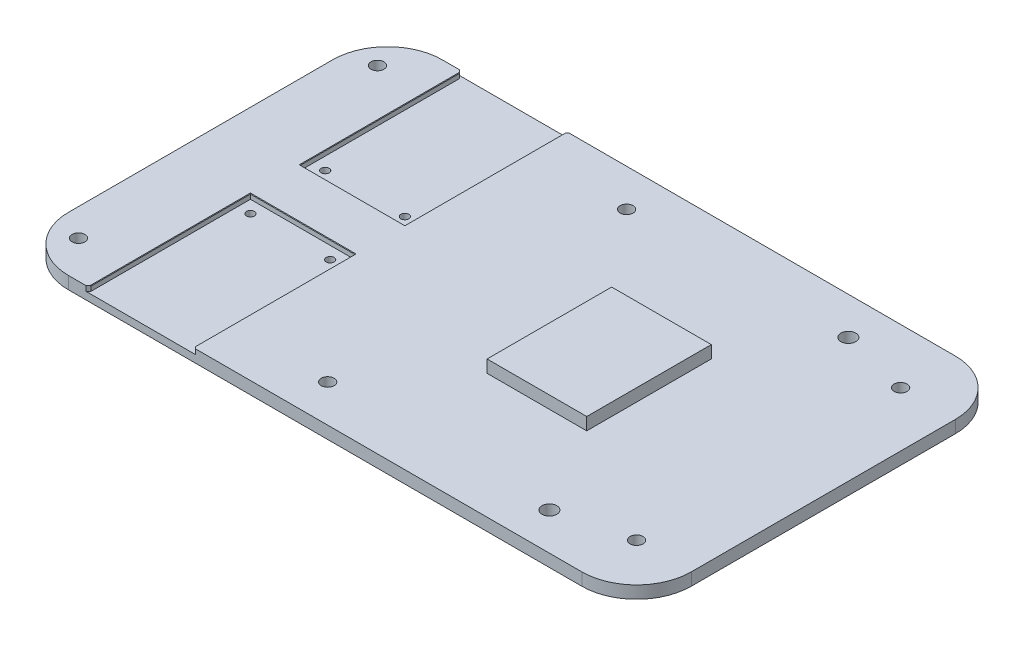
from build123d import *

# Parameters (mm, degrees)
SKETCH_1_R          = 2.6
SKETCH_1_R_2        = 3
EXTRUDE_1_DEPTH     = 5
SKETCH_2_W          = 42
SKETCH_2_H          = 65
CUT_EXTRUDE_1_DEPTH = 2
CHAMFER_1_SIZE      = 0.2
CHAMFER_2_SIZE      = 1
SKETCH_3_R          = 1.6
CUT_EXTRUDE_2_DEPTH = 3
SKETCH_4_W          = 40
SKETCH_4_H          = 50
EXTRUDE_2_DEPTH     = 5


with BuildPart() as part:
    # 草图1 → 凸台-拉伸1 (new body)
    with BuildSketch(Plane(origin=(0, 0, 0), x_dir=(1, 0, 0), z_dir=(0, 1, 0))):
        with BuildLine():
            Line((103, 75), (-103, 75))
            ThreePointArc((-103, 75), (-118.556349186, 68.556349186), (-125, 53))
            Line((-125, 53), (-125, -53))
            ThreePointArc((-125, -53), (-118.556349186, -68.556349186), (-103, -75))
            Line((-103, -75), (103, -75))
            ThreePointArc((103, -75), (118.556349186, -68.556349186), (125, -53))
            Line((125, -53), (125, 53))
            ThreePointArc((125, 53), (118.556349186, 68.556349186), (103, 75))
        make_face()
        with Locations((-114, 60)):
            Circle(SKETCH_1_R, mode=Mode.SUBTRACT)
        with Locations((-14, 60)):
            Circle(SKETCH_1_R, mode=Mode.SUBTRACT)
        with Locations((103, 53)):
            Circle(SKETCH_1_R, mode=Mode.SUBTRACT)
        with Locations((-114, -60)):
            Circle(SKETCH_1_R, mode=Mode.SUBTRACT)
        with Locations((-14, -60)):
            Circle(SKETCH_1_R, mode=Mode.SUBTRACT)
        with Locations((103, -53)):
            Circle(SKETCH_1_R, mode=Mode.SUBTRACT)
        with Locations((75, -60)):
            Circle(SKETCH_1_R_2, mode=Mode.SUBTRACT)
        with Locations((75, 60)):
            Circle(SKETCH_1_R_2, mode=Mode.SUBTRACT)
    extrude(amount=EXTRUDE_1_DEPTH)

    # 草图2 → 切除-拉伸1 (cut)
    with BuildSketch(Plane(origin=(0, 5, 0), x_dir=(1, 0, 0), z_dir=(0, 1, 0))):
        with Locations((-74, -42.5)):
            Rectangle(SKETCH_2_W, SKETCH_2_H)
        with Locations((-74, 42.5)):
            Rectangle(SKETCH_2_W, SKETCH_2_H)
    extrude(amount=-CUT_EXTRUDE_1_DEPTH, mode=Mode.SUBTRACT)

    # 倒角1
    chamfer_1_edges = [part.edges().sort_by_distance(p)[0] for p in [
        (-53, 5, -42.5),
        (-74, 5, -10),
        (-95, 5, -42.5),
        (-53, 5, 42.5),
        (-74, 5, 10),
        (-95, 5, 42.5),
    ]]
    chamfer(chamfer_1_edges, length=CHAMFER_1_SIZE)

    # 倒角2
    chamfer_2_edges = [part.edges().sort_by_distance(p)[0] for p in [
        (-53, 3.9, 75),
        (-95, 3.9, 75),
        (-95, 3.9, -75),
        (-53, 3.9, -75),
    ]]
    chamfer(chamfer_2_edges, length=CHAMFER_2_SIZE)

    # 草图3 → 切除-拉伸2 (cut)
    with BuildSketch(Plane(origin=(0, 3, 0), x_dir=(1, 0, 0), z_dir=(0, 1, 0))):
        with Locations((-90, 15)):
            Circle(SKETCH_3_R)
        with Locations((-58, 15)):
            Circle(SKETCH_3_R)
        with Locations((-58, -15)):
            Circle(SKETCH_3_R)
        with Locations((-90, -15)):
            Circle(SKETCH_3_R)
    extrude(amount=-CUT_EXTRUDE_2_DEPTH, mode=Mode.SUBTRACT)

    # 草图4 → 凸台-拉伸2 (add)
    with BuildSketch(Plane(origin=(0, 5, 0), x_dir=(1, 0, 0), z_dir=(0, 1, 0))):
        with Locations((35, 0)):
            Rectangle(SKETCH_4_W, SKETCH_4_H)
    extrude(amount=EXTRUDE_2_DEPTH)


solid = part.part
